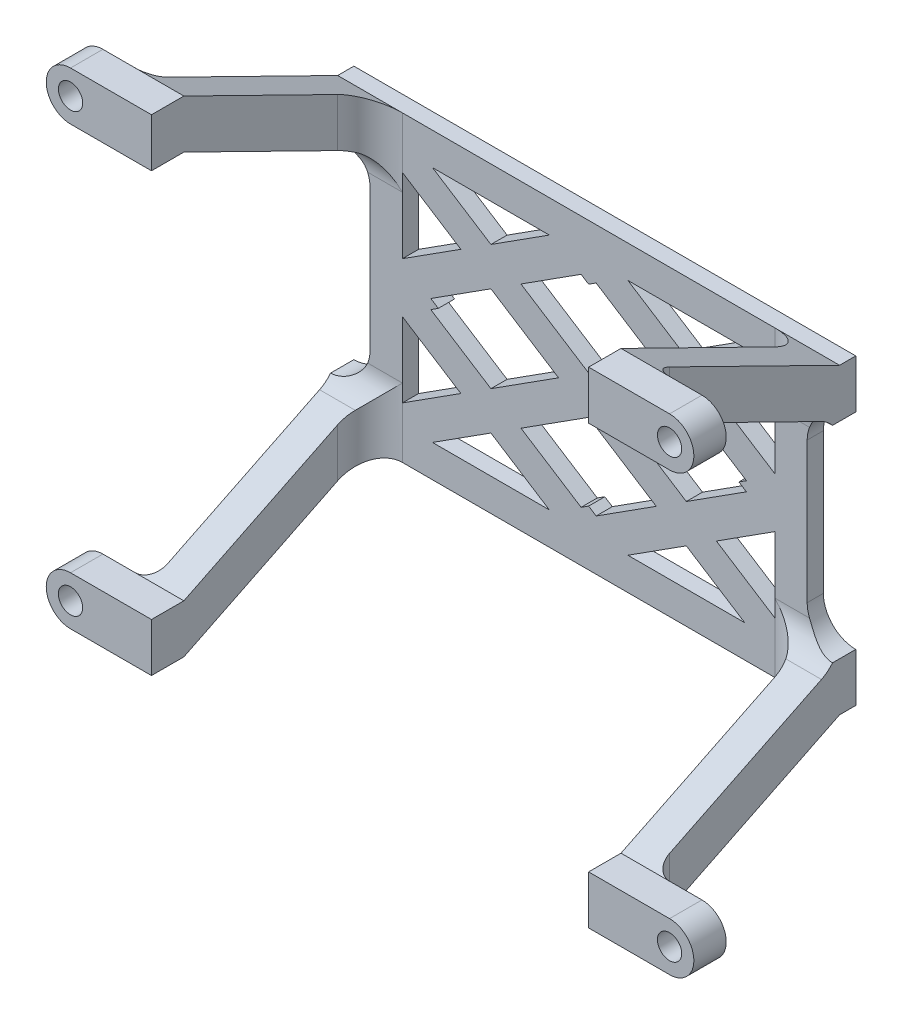
from build123d import *

# Parameters (mm, degrees)
SKETCH1_W                = 54
SKETCH1_H                = 37.4
BOSS_EXTRUDE1_DEPTH      = 2
CUT_EXTRUDE1_DEPTH       = 54.160020758
SKETCH4_R                = 3
SKETCH4_R_2              = 1.5
BOSS_EXTRUDE2_DEPTH      = 4
BOSS_EXTRUDE3_REACH      = 75.013
BOSS_EXTRUDE3_END_RADIUS = 3
SKETCH6_W                = 4
SKETCH6_H                = 6
LOFT1_START              = -48.911518112
LOFT1_DEPTH              = 4
SKETCH8_2_W              = 4
SKETCH8_2_H              = 6
BOSS_EXTRUDE4_DEPTH      = 2
FILLET5_R                = 2
FILLET1_R                = 4
FILLET2_R                = 4
FILLET3_R                = 4
INTERSECT1_START         = -9.028476462
INTERSECT1_OUTLINE_W     = 54
INTERSECT1_OUTLINE_H     = 2
INTERSECT1_DEPTH         = 18.7
INTERSECT2_START         = -17.911518112
INTERSECT2_OUTLINE_W     = 18.7
INTERSECT2_OUTLINE_H     = 2
INTERSECT2_DEPTH         = 27


# Read off the part's stored shape, not the designer's step: Loft1, Intersect1, Intersect2
with BuildPart() as part:
    # Sketch1 → Boss-Extrude1 (new body)
    with BuildSketch(Plane.XY):
        with Locations((-17.911518112, 9.671523538)):
            Rectangle(SKETCH1_W, SKETCH1_H)
    extrude(amount=BOSS_EXTRUDE1_DEPTH)

    # Sketch2 → Cut-Extrude1 (cut, through all)
    with BuildSketch(Plane.XY.offset(2)):
        Polygon((-22.764922959, 24.371523538), (-29.981326879, 19.759300163), (-37.197730799, 24.371523538), align=None)
        Polygon((-33.695114192, 17.385705663), (-40.911518112, 12.773482289), (-40.911518112, 21.997929038), align=None)
        Polygon((-29.981326879, 15.012111163), (-37.408901505, 10.264922163), (-29.052880051, 4.924334538), (-21.625305425, 9.671523538), align=None)
        Polygon((-18.83996494, 22.132894663), (-26.267539566, 17.385705663), (-17.911518112, 12.045118038), (-10.483943486, 16.792307038), align=None)
        Polygon((1.374694575, 24.371523538), (-14.915006921, 24.371523538), (-6.770156173, 19.165901538), align=None)
        Polygon((-3.05636886, 16.792307038), (5.088481888, 11.586685039), (5.088481888, 21.997929038), align=None)
        Polygon((-6.770156173, 14.418712538), (-14.197730799, 9.671523538), (-5.841709344, 4.330935913), (1.585865282, 9.078124913), align=None)
        Polygon((-17.911518112, 7.297929038), (-25.339092738, 2.550740038), (-16.983071283, -2.789847587), (-9.555496657, 1.957341413), align=None)
        Polygon((-29.052880051, 0.177145538), (-20.908029303, -5.028476462), (-37.197730799, -5.028476462), align=None)
        Polygon((-40.911518112, 7.756362038), (-32.766667364, 2.550740038), (-40.911518112, -2.654881962), align=None)
        Polygon((-13.058113264, -5.028476462), (-5.841709344, -0.416253087), (1.374694575, -5.028476462), align=None)
        Polygon((-2.127922031, 1.957341413), (5.088481888, 6.569564788), (5.088481888, -2.654881962), align=None)
    extrude(amount=-CUT_EXTRUDE1_DEPTH, mode=Mode.SUBTRACT)



with BuildPart() as body_2:
    # Sketch4 → Boss-Extrude2 (new body)
    with BuildSketch(Plane.XY.offset(25)):
        with Locations((-54.911518112, 36.671523538)):
            Circle(SKETCH4_R)
        with Locations((-54.911518112, 36.671523538)):
            Circle(SKETCH4_R_2, mode=Mode.SUBTRACT)
    extrude(amount=BOSS_EXTRUDE2_DEPTH)

    # Boss-Extrude3: up to this cylinder (the profile starts outside it)
    boss_extrude3_end = Plane(origin=(-54.911518112, 36.671523538, 27), z_dir=(0, 0, -1)) * Cylinder(BOSS_EXTRUDE3_END_RADIUS, 157.026, mode=Mode.PRIVATE)
    # Sketch6 → Boss-Extrude3 (add, up to the surface)
    with BuildSketch(Plane.ZY.offset(44.911518112), mode=Mode.PRIVATE) as boss_extrude3_sk1:
        with Locations((27, 36.671523538)):
            Rectangle(SKETCH6_W, SKETCH6_H)
    boss_extrude3_tool1 = extrude(boss_extrude3_sk1.sketch, amount=BOSS_EXTRUDE3_REACH, mode=Mode.PRIVATE) - boss_extrude3_end
    add(boss_extrude3_tool1.solids().sort_by_distance((-44.911518, 36.671524, 27))[0])

    # Loft1 outline → Loft1 (add)
    with BuildSketch(Plane.YZ.offset(LOFT1_START)):
        Polygon((22.371523538, 2), (28.371523538, 2), (39.671523538, 25), (33.671523538, 25), align=None)
    extrude(amount=LOFT1_DEPTH)


with BuildPart() as part_1:
    add(part.part)

    add(body_2.part)  # Boss-Extrude4 merges body 2
    # Sketch8<2> → Boss-Extrude4 (add)
    with BuildSketch(Plane.XY.offset(2)):
        with Locations((-46.911518112, 25.371523538)):
            Rectangle(SKETCH8_2_W, SKETCH8_2_H)
    extrude(amount=-BOSS_EXTRUDE4_DEPTH)

    # Fillet5
    fillet5_edges = [part_1.edges().sort_by_distance(p)[0] for p in [
        (-48.911518112, 36.671523538, 25),
    ]]
    fillet(fillet5_edges, radius=FILLET5_R)

    # Fillet1
    # the kernel refuses this fillet: 4 mm, written as the material it adds along each edge
    with BuildSketch(Plane(origin=(-44.911518112, 22.371523538, 2), x_dir=(-1, 0, 0), z_dir=(0, 0, -1))) as fillet1_piece_1:
        with BuildLine():
            CenterArc((FILLET1_R, -FILLET1_R), FILLET1_R, 90, 90)
            Line((0, -FILLET1_R), (0, 0))
            Line((0, 0), (FILLET1_R, 0))
        make_face()
    extrude(amount=2)

    # Fillet2
    fillet2_edges = [part_1.edges().sort_by_distance(p)[0] for p in [
        (-44.911518112, 25.371523538, 2),
    ]]
    fillet(fillet2_edges, radius=FILLET2_R)

    # Fillet3
    # the kernel refuses this fillet: 4 mm, written as the material it adds along each edge
    with BuildSketch(Plane(origin=(-40.911518112, 22.371523538, 2), x_dir=(-1.1887379968908428e-11, -1.0, 0), z_dir=(-1.0, 1.188737996890843e-11, 0))) as fillet3_piece_1_section:
        with BuildLine():
            CenterArc((FILLET3_R * 0.622867973762, FILLET3_R), FILLET3_R, 206.165087136, 63.834912864)
            Line((-FILLET3_R * 0.274659258448, FILLET3_R * 0.559040968523), (0, 0))
            Line((0, 0), (FILLET3_R * 0.622867973762, 0))
        make_face()
    fillet3_piece_1 = extrude(amount=8, mode=Mode.PRIVATE)
    fillet3_piece_1 = fillet3_piece_1 - Plane(origin=(-48.911518112, 18.371523538, 2.009489355), x_dir=(-1, 0, 0), z_dir=(0, 0, 1)) * Cylinder(4, 26, mode=Mode.PRIVATE)
    fillet3_piece_1 = fillet3_piece_1 - Plane(origin=(-40.911518112, 22.302452917, 6), x_dir=(0, 0, -1), z_dir=(0, 1, 0)) * Cylinder(4, 26, mode=Mode.PRIVATE)
    add(fillet3_piece_1)

    # Intersect1 outline → Intersect1 (cut)
    with BuildSketch(Plane(origin=(0, 0, 0), x_dir=(1, 0, 0), z_dir=(0, 1, 0)).offset(INTERSECT1_START)):
        with Locations((-17.911518112, -1)):
            Rectangle(INTERSECT1_OUTLINE_W, INTERSECT1_OUTLINE_H)
    extrude(amount=INTERSECT1_DEPTH, mode=Mode.SUBTRACT)

    # Intersect2 outline → Intersect2 (cut)
    with BuildSketch(Plane.YZ.offset(INTERSECT2_START)):
        with Locations((19.021523538, 1)):
            Rectangle(INTERSECT2_OUTLINE_W, INTERSECT2_OUTLINE_H)
    extrude(amount=INTERSECT2_DEPTH, mode=Mode.SUBTRACT)

    # Mirror3: part across plane


with BuildPart() as part_2:
    add(part_1.part)
    add(part_1.part.mirror(Plane.ZY.offset(17.911518112)))

    # Mirror4: part across plane


with BuildPart() as part_3:
    add(part_2.part)
    add(part_2.part.mirror(Plane.ZX.offset(9.671523538)))


solid = part_3.part
